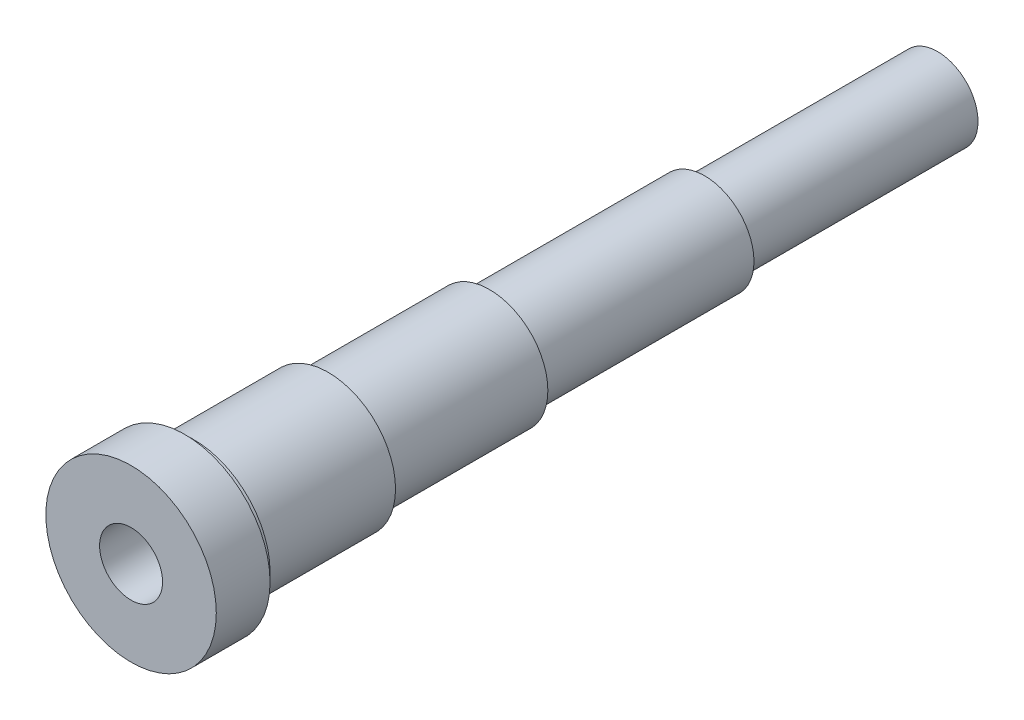
from build123d import *


with BuildPart() as part:
    # Sketch1 → Revolve1 (revolve)
    with BuildSketch(Plane(origin=(0, 0, 0), x_dir=(0, 0, -1), z_dir=(1, 0, 0))):
        Polygon((-238.175017721, 18.0848), (-238.175017721, -3.61696), (87.351382279, -3.61696), (87.351382279, 0), (-6.689577721, 0), (-6.689577721, 3.61696), (-93.496617721, 3.61696), (-93.496617721, 7.23392), (-158.601897721, 7.23392), (-158.601897721, 10.85088), (-212.856297721, 10.85088), (-212.856297721, 14.46784), (-216.473257721, 14.46784), (-216.473257721, 18.0848), align=None)
    revolve(axis=Axis((0, -16.31696, 254.825393325), (0, 0, -1)))


solid = part.part
